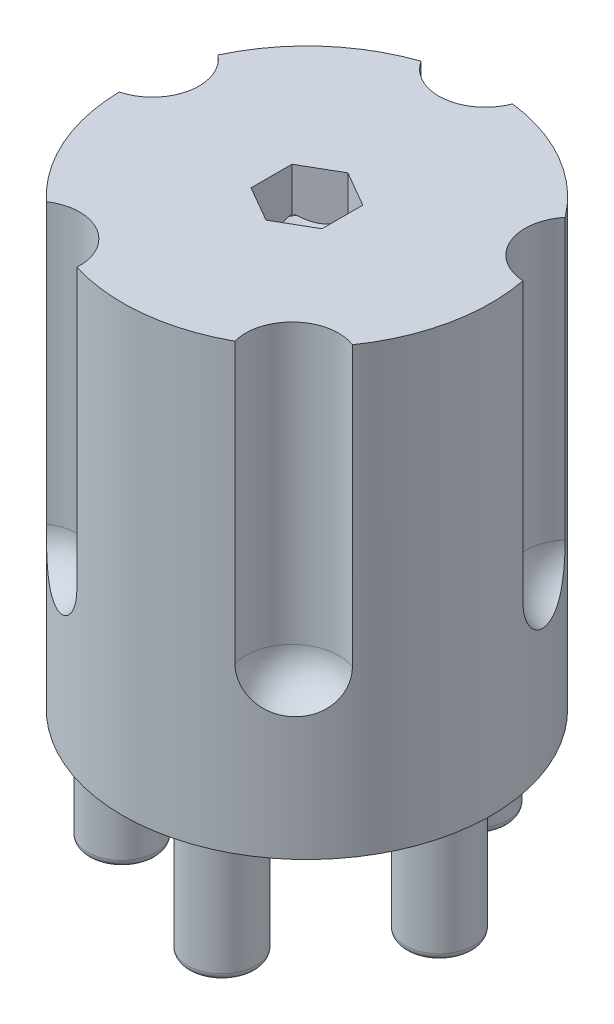
from build123d import *

# Parameters (mm, degrees)
SKETCH1_R           = 25.75
BOSS_EXTRUDE1_DEPTH = 62
SKETCH2_R           = 4.75
BOSS_EXTRUDE2_DEPTH = 18
FILLET1_R           = 1
FILLET2_R           = 1
CUT_EXTRUDE1_DEPTH  = 6.1
SKETCH4_R           = 10
CUT_EXTRUDE2_DEPTH  = 45
SKETCH5_R           = 3
CUT_EXTRUDE3_DEPTH  = 73.767609553
CHAMFER2_SIZE       = 2.5
CHAMFER2_SIZE2      = 3.4
SKETCH6_R           = 6.5
CUT_EXTRUDE4_DEPTH  = 45
FILLET3_R           = 6
CHAMFER3_SIZE       = 2.5


with BuildPart() as part:
    # Sketch1 → Boss-Extrude1 (new body)
    with BuildSketch(Plane(origin=(0, 0, 0), x_dir=(1, 0, 0), z_dir=(0, 1, 0))):
        with Locations(Location((0, 0, 0), (0, 0, 270))):
            Circle(SKETCH1_R)
    extrude(amount=BOSS_EXTRUDE1_DEPTH)

    # Sketch2 → Boss-Extrude2 (add)
    with BuildSketch(Plane.XZ):
        with Locations(Location((18.5, 0, 0), (0, 0, 90))):
            Circle(SKETCH2_R)
        with Locations(Location((5.716814396, -17.594545551, 0), (0, 0, 90))):
            Circle(SKETCH2_R)
        with Locations(Location((-14.966814396, -10.874027167, 0), (0, 0, 90))):
            Circle(SKETCH2_R)
        with Locations(Location((-14.966814396, 10.874027167, 0), (0, 0, 90))):
            Circle(SKETCH2_R)
        with Locations(Location((5.716814396, 17.594545551, 0), (0, 0, 90))):
            Circle(SKETCH2_R)
    extrude(amount=BOSS_EXTRUDE2_DEPTH)

    # Fillet1
    fillet1_edges = [part.edges().sort_by_distance(p)[0] for p in [
        (-14.966814396, 0, -15.624027167),
        (-14.966814396, 0, 6.124027167),
        (5.716814396, 0, 12.844545551),
        (18.5, 0, -4.75),
        (5.716814396, 0, -22.344545551),
    ]]
    fillet(fillet1_edges, radius=FILLET1_R)

    # Fillet2
    fillet2_edges = [part.edges().sort_by_distance(p)[0] for p in [
        (-14.966814396, -18, -15.624027167),
        (-14.966814396, -18, 6.124027167),
        (5.716814396, -18, 12.844545551),
        (18.5, -18, -4.75),
        (5.716814396, -18, -22.344545551),
    ]]
    fillet(fillet2_edges, radius=FILLET2_R)

    # Sketch3 → Cut-Extrude1 (cut)
    with BuildSketch(Plane(origin=(0, 62, 0), x_dir=(1, 0, 0), z_dir=(0, 1, 0))):
        Polygon((0, -5.715767665), (4.95, -2.857883832), (4.95, 2.857883832), (0, 5.715767665), (-4.95, 2.857883832), (-4.95, -2.857883832), align=None)
    extrude(amount=-CUT_EXTRUDE1_DEPTH, mode=Mode.SUBTRACT)

    # Sketch4 → Cut-Extrude2 (cut)
    with BuildSketch(Plane.XZ):
        with Locations(Location((0, 0, 0), (0, 0, 270))):
            Circle(SKETCH4_R)
    extrude(amount=-CUT_EXTRUDE2_DEPTH, mode=Mode.SUBTRACT)

    # Sketch5 → Cut-Extrude3 (cut, through all)
    with BuildSketch(Plane.XZ.offset(-45)):
        with Locations(Location((0, 0, 0), (0, 0, 270))):
            Circle(SKETCH5_R)
    extrude(amount=-CUT_EXTRUDE3_DEPTH, mode=Mode.SUBTRACT)

    # Chamfer2
    chamfer2_edges = [part.edges().sort_by_distance(p)[0] for p in [
        (0, 45, 3),
    ]]
    chamfer2_side = [part.faces().sort_by_distance(p)[0] for p in [
        (0, 45, 9.717157288),
    ]]
    chamfer(chamfer2_edges, length=CHAMFER2_SIZE, length2=CHAMFER2_SIZE2, reference=chamfer2_side[0])

    # Sketch6 → Cut-Extrude4 (cut)
    with BuildSketch(Plane(origin=(0, 62, 0), x_dir=(1, 0, 0), z_dir=(0, 1, 0))):
        with Locations((-14, -24.248711306)):
            Circle(SKETCH6_R)
        with Locations((-27.388132821, 5.821527343)):
            Circle(SKETCH6_R)
        with Locations((-2.926796971, 27.84661307)):
            Circle(SKETCH6_R)
        with Locations((25.579272814, 11.388626006)):
            Circle(SKETCH6_R)
        with Locations((18.735656978, -20.808055113)):
            Circle(SKETCH6_R)
    extrude(amount=-CUT_EXTRUDE4_DEPTH, mode=Mode.SUBTRACT)

    # Fillet3
    # the kernel refuses this fillet: 6 mm, written as the material it adds along each edge
    with BuildSketch(Plane(origin=(-14, 17, 24.248711306), x_dir=(-0.5027182271719127, 0, 0.8644503363809452), z_dir=(0.8644503363809452, 0, 0.5027182271719127))) as fillet3_piece_1_section:
        with BuildLine():
            CenterArc((6.5 - FILLET3_R, -FILLET3_R), FILLET3_R, 0, 90)
            Line((6.5, -FILLET3_R), (6.5, 0))
            Line((6.5, 0), (6.5 - FILLET3_R, 0))
        make_face()
    fillet3_piece_1 = revolve(axis=Axis((-14, 17, 24.248711306), (0, -1, 0)), revolution_arc=359.64, mode=Mode.PRIVATE)
    fillet3_piece_1 = fillet3_piece_1 & Plane(origin=(0, 19.401898433, 0), x_dir=(0, 0, 1), z_dir=(0, -1, 0)) * Cylinder(25.75, 26, mode=Mode.PRIVATE)
    add(fillet3_piece_1)
    with BuildSketch(Plane(origin=(-27.388132821, 17, -5.821527343), x_dir=(-0.9774896010068019, 0, -0.21098360107734276), z_dir=(-0.21098360107734276, 0, 0.9774896010068019))) as fillet3_piece_2_section:
        with BuildLine():
            CenterArc((6.5 - FILLET3_R, -FILLET3_R), FILLET3_R, 0, 90)
            Line((6.5, -FILLET3_R), (6.5, 0))
            Line((6.5, 0), (6.5 - FILLET3_R, 0))
        make_face()
    fillet3_piece_2 = revolve(axis=Axis((-27.388132821, 17, -5.821527343), (0, -1, 0)), revolution_arc=359.64, mode=Mode.PRIVATE)
    fillet3_piece_2 = fillet3_piece_2 & Plane(origin=(0, 19.401898433, 0), x_dir=(0, 0, 1), z_dir=(0, -1, 0)) * Cylinder(25.75, 26, mode=Mode.PRIVATE)
    add(fillet3_piece_2)
    with BuildSketch(Plane(origin=(-2.926796971, 17, -27.84661307), x_dir=(-0.1076523249817097, 0, -0.9941886022913521), z_dir=(0.9941886022913521, 0, -0.1076523249817097))) as fillet3_piece_3_section:
        with BuildLine():
            CenterArc((6.5 - FILLET3_R, FILLET3_R), FILLET3_R, 270, 90)
            Line((6.5, FILLET3_R), (6.5, 0))
            Line((6.5, 0), (6.5 - FILLET3_R, 0))
        make_face()
    fillet3_piece_3 = revolve(axis=Axis((-2.926796971, 17, -27.84661307), (0, 1, 0)), revolution_arc=359.64, mode=Mode.PRIVATE)
    fillet3_piece_3 = fillet3_piece_3 & Plane(origin=(0, 19.401898433, 0), x_dir=(0, 0, 1), z_dir=(0, -1, 0)) * Cylinder(25.75, 26, mode=Mode.PRIVATE)
    add(fillet3_piece_3)
    with BuildSketch(Plane(origin=(25.579272814, 17, -11.388626006), x_dir=(0.9122631507322384, 0, -0.40960461889008193), z_dir=(0.40960461889008193, 0, 0.9122631507322384))) as fillet3_piece_4_section:
        with BuildLine():
            CenterArc((6.5 - FILLET3_R, FILLET3_R), FILLET3_R, 270, 90)
            Line((6.5, FILLET3_R), (6.5, 0))
            Line((6.5, 0), (6.5 - FILLET3_R, 0))
        make_face()
    fillet3_piece_4 = revolve(axis=Axis((25.579272814, 17, -11.388626006), (0, 1, 0)), revolution_arc=359.64, mode=Mode.PRIVATE)
    fillet3_piece_4 = fillet3_piece_4 & Plane(origin=(0, 19.401898433, 0), x_dir=(0, 0, 1), z_dir=(0, -1, 0)) * Cylinder(25.75, 27, mode=Mode.PRIVATE)
    add(fillet3_piece_4)
    with BuildSketch(Plane(origin=(18.735656978, 17, 20.808055113), x_dir=(0.6714619588183017, 0, 0.7410390258683339), z_dir=(-0.7410390258683339, 0, 0.6714619588183017))) as fillet3_piece_5_section:
        with BuildLine():
            CenterArc((6.5 - FILLET3_R, FILLET3_R), FILLET3_R, 270, 90)
            Line((6.5, FILLET3_R), (6.5, 0))
            Line((6.5, 0), (6.5 - FILLET3_R, 0))
        make_face()
    fillet3_piece_5 = revolve(axis=Axis((18.735656978, 17, 20.808055113), (0, 1, 0)), revolution_arc=359.64, mode=Mode.PRIVATE)
    fillet3_piece_5 = fillet3_piece_5 & Plane(origin=(0, 19.401898433, 0), x_dir=(0, 0, 1), z_dir=(0, -1, 0)) * Cylinder(25.75, 26, mode=Mode.PRIVATE)
    add(fillet3_piece_5)

    # Chamfer3
    # the kernel refuses this chamfer: 2.5 mm, written as the material it takes off along each edge
    with BuildSketch(Plane(origin=(0, 55.9, 0), x_dir=(0, 0, -1), z_dir=(-1, 0, 0))) as chamfer3_piece_1_section:
        Polygon((3 + CHAMFER3_SIZE, 0), (3, CHAMFER3_SIZE), (3, 0), align=None)
    chamfer3_piece_1 = revolve(axis=Axis((0, 55.9, 0), (0, -1, 0)), mode=Mode.PRIVATE)
    chamfer3_piece_1 = split(chamfer3_piece_1, bisect_by=Plane(origin=(0.647838444, 54.680351136, 5.341737965), z_dir=(-0.4999999999999998, 0, -0.8660254037844388)), keep=Keep.TOP, mode=Mode.PRIVATE)
    chamfer3_piece_1 = split(chamfer3_piece_1, bisect_by=Plane(origin=(-0.647838444, 54.680351136, 5.341737965), z_dir=(0.5000000000000001, 0, -0.8660254037844386)), keep=Keep.TOP, mode=Mode.PRIVATE)
    chamfer3_piece_1 = split(chamfer3_piece_1, bisect_by=Plane(origin=(-4.95, 54.680351136, 4.219648864), z_dir=(1, 0, 0)), keep=Keep.TOP, mode=Mode.PRIVATE)
    chamfer3_piece_1 = split(chamfer3_piece_1, bisect_by=Plane(origin=(-4.302161556, 54.680351136, -3.231913533), z_dir=(0.49999999999999983, 0, 0.8660254037844388)), keep=Keep.TOP, mode=Mode.PRIVATE)
    chamfer3_piece_1 = split(chamfer3_piece_1, bisect_by=Plane(origin=(4.302161556, 54.680351136, -3.231913533), z_dir=(-0.5000000000000001, 0, 0.8660254037844386)), keep=Keep.TOP, mode=Mode.PRIVATE)
    chamfer3_piece_1 = split(chamfer3_piece_1, bisect_by=Plane(origin=(4.95, 54.680351136, 4.219648864), z_dir=(-1, 0, 0)), keep=Keep.TOP, mode=Mode.PRIVATE)
    add(chamfer3_piece_1, mode=Mode.SUBTRACT)


solid = part.part
